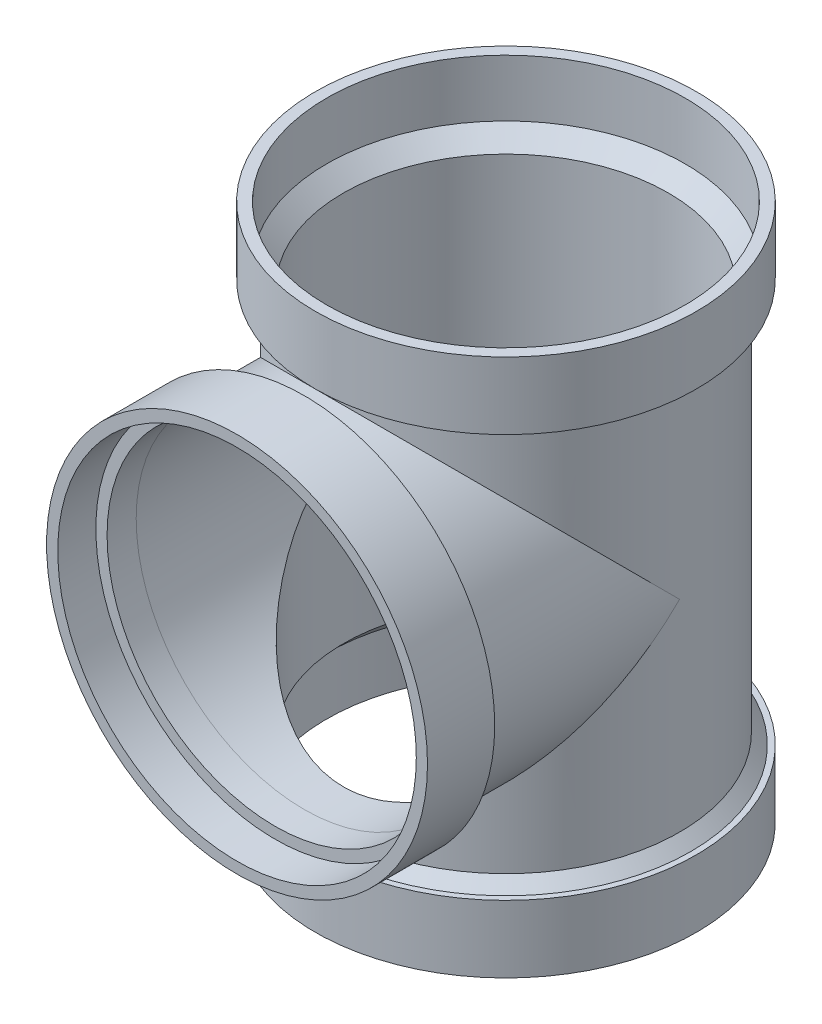
from build123d import *

# Parameters (mm, degrees)
SKETCH1_R            = 77.5
BOSS_EXTRUDE1_DEPTH  = 180
SKETCH2_R            = 77.5
BOSS_EXTRUDE2_DEPTH  = 90
SKETCH5_R            = 85
BOSS_EXTRUDE3_DEPTH  = 30
BOSS_EXTRUDE4_START  = 30
SKETCH6_R            = 85
BOSS_EXTRUDE4_DEPTH  = 30
SKETCH8_R            = 85
BOSS_EXTRUDE12_DEPTH = 30
SKETCH9_R            = 80
CUT_EXTRUDE1_DEPTH   = 17
SKETCH10_R           = 75
CUT_EXTRUDE2_DEPTH   = 17
CHAMFER1_SIZE        = 5
SKETCH16_R           = 75
CUT_EXTRUDE3_DEPTH   = 80


# Read off the part's stored shape, not the designer's step: Shell1
with BuildPart() as part:
    # Sketch1 → Boss-Extrude1 (new body)
    with BuildSketch(Plane(origin=(0, 0, 0), x_dir=(1, 0, 0), z_dir=(0, 1, 0))):
        with Locations(Location((0, 0, 0), (0, 0, 90))):
            Circle(SKETCH1_R)
    extrude(amount=BOSS_EXTRUDE1_DEPTH)

    # Sketch2 → Boss-Extrude2 (add)
    with BuildSketch(Plane.XY):
        with Locations((0, 95)):
            Circle(SKETCH2_R)
    extrude(amount=BOSS_EXTRUDE2_DEPTH)

    # Sketch5 → Boss-Extrude3 (add)
    with BuildSketch(Plane.XZ):
        with Locations(Location((0, 0, 0), (0, 0, 270))):
            Circle(SKETCH5_R)
    extrude(amount=BOSS_EXTRUDE3_DEPTH)

    # Sketch6 → Boss-Extrude4 (add)
    with BuildSketch(Plane(origin=(0, 180, 0), x_dir=(1, 0, 0), z_dir=(0, 1, 0)).offset(BOSS_EXTRUDE4_START)):
        with Locations(Location((0, 0, 0), (0, 0, 90))):
            Circle(SKETCH6_R)
    extrude(amount=-BOSS_EXTRUDE4_DEPTH)


with BuildPart() as body_2:
    # Sketch8 → Boss-Extrude12 (new body)
    with BuildSketch(Plane.XY.offset(90)):
        with Locations((0, 95)):
            Circle(SKETCH8_R)
    extrude(amount=BOSS_EXTRUDE12_DEPTH)

    # Sketch9 → Cut-Extrude1 (cut)
    with BuildSketch(Plane.XY.offset(120)):
        with Locations((0, 95)):
            Circle(SKETCH9_R)
    extrude(amount=-CUT_EXTRUDE1_DEPTH, mode=Mode.SUBTRACT)


with BuildPart() as cut_extrude2_tool:
    # Sketch10 → Cut-Extrude2 (new body)
    with BuildSketch(Plane.XY.offset(103)):
        with Locations((0, 95)):
            Circle(SKETCH10_R)
    extrude(amount=-CUT_EXTRUDE2_DEPTH)


with BuildPart() as part_1:
    add(part.part)

    # Cut-Extrude2: cut by cut_extrude2_tool
    add(cut_extrude2_tool.part, mode=Mode.SUBTRACT)

    # Chamfer1
    chamfer1_edges = [part_1.edges().sort_by_distance(p)[0] for p in [
        (0, 0, 77.5),
        (0, 180, 77.5),
    ]]
    chamfer(chamfer1_edges, length=CHAMFER1_SIZE)

    # Shell1 outline → Shell1 (revolve, cut)
    with BuildSketch(Plane.XY):
        Polygon((80, 210), (0, 210), (0, -30), (80, -30), (80, -4.571067812), (72.5, 2.928932188), (72.5, 177.071067812), (80, 184.571067812), align=None)
    revolve(axis=Axis((0, 0, 0), (0, 1, 0)), mode=Mode.SUBTRACT)

    # Sketch16 → Cut-Extrude3 (cut)
    with BuildSketch(Plane.XY.offset(86)):
        with Locations((0, 95)):
            Circle(SKETCH16_R)
    extrude(amount=-CUT_EXTRUDE3_DEPTH, mode=Mode.SUBTRACT)


with BuildPart() as body_2_1:
    add(body_2.part)

    # Cut-Extrude2: cut by cut_extrude2_tool
    add(cut_extrude2_tool.part, mode=Mode.SUBTRACT)


solid = Compound([part_1.part, body_2_1.part])
